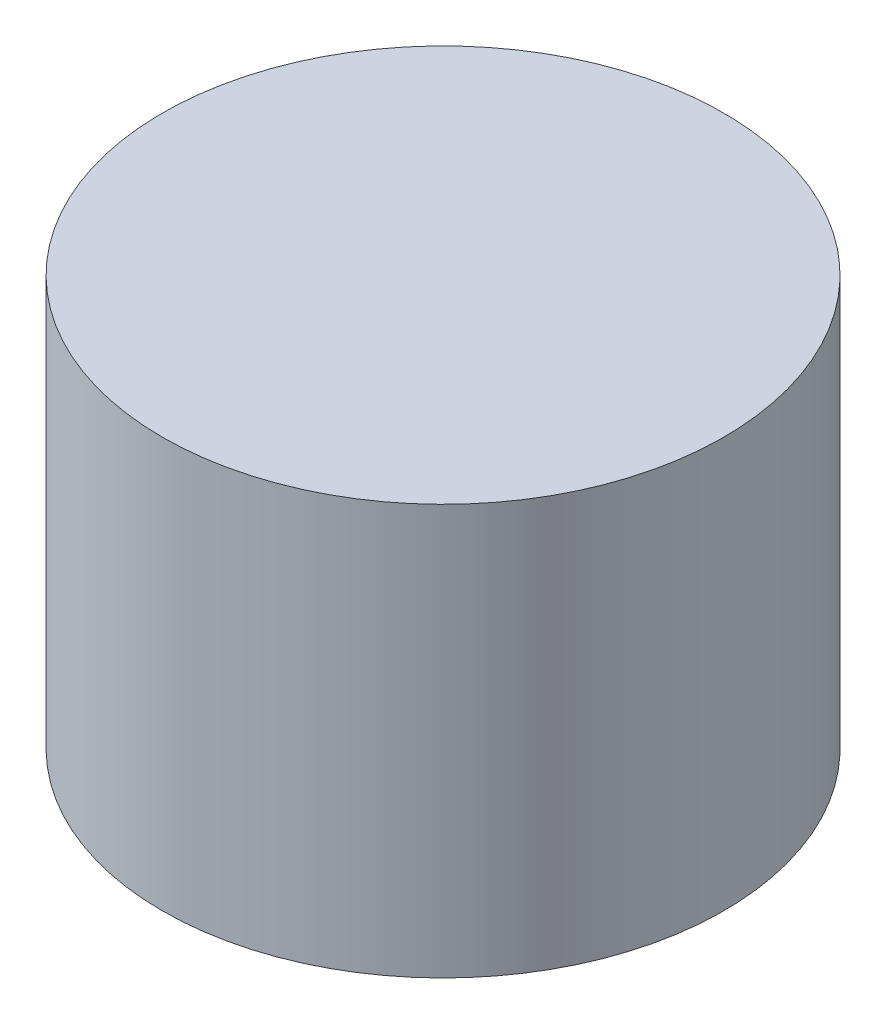
from build123d import *

# Parameters (mm, degrees)
SKETCH2_R           = 15
BOSS_EXTRUDE1_DEPTH = 10.96


with BuildPart() as part:
    # Sketch2 → Boss-Extrude1 (new, symmetric)
    with BuildSketch(Plane(origin=(0, 0, 0), x_dir=(1, 0, 0), z_dir=(0, 1, 0))):
        Circle(SKETCH2_R)
    extrude(amount=BOSS_EXTRUDE1_DEPTH, both=True)


solid = part.part
